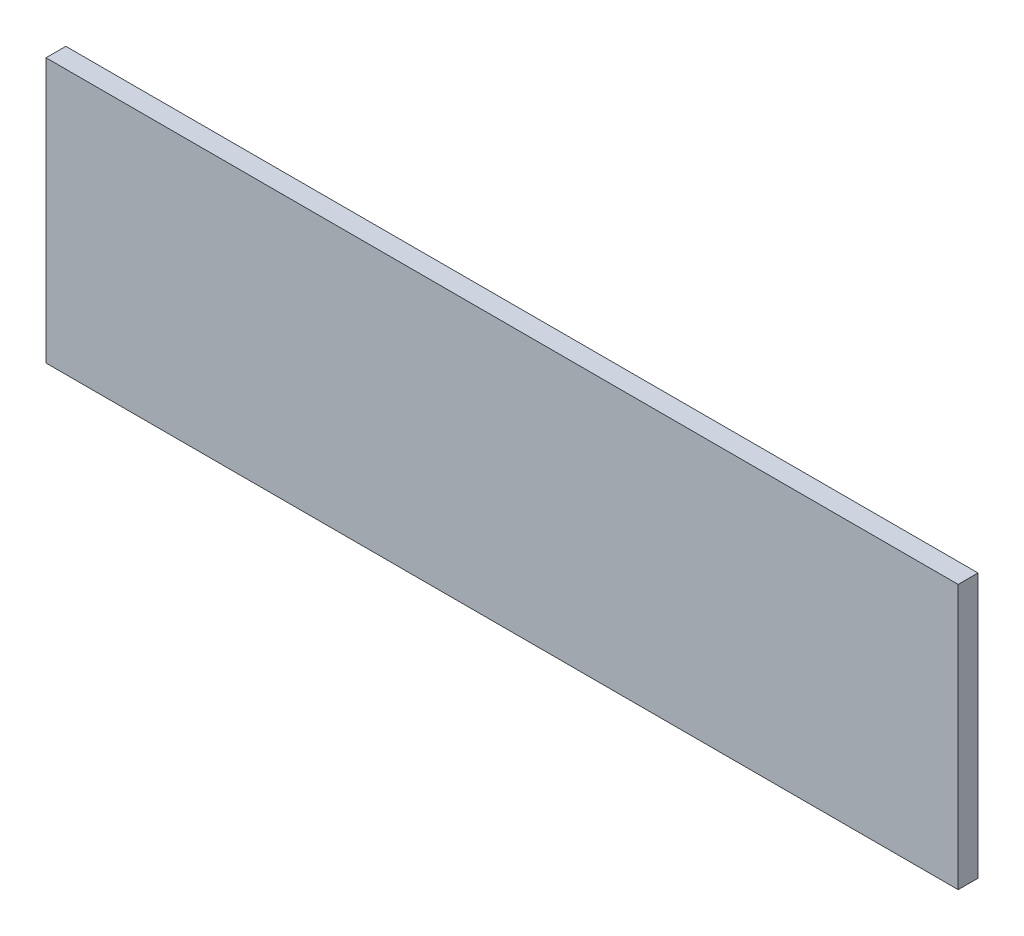
from build123d import *

# Parameters (mm, degrees)
CROQUIS1_W              = 690
CROQUIS1_H              = 200
SALIENTE_EXTRUIR1_DEPTH = 15


with BuildPart() as part:
    # Croquis1 → Saliente-Extruir1 (new body)
    with BuildSketch(Plane.XY):
        Rectangle(CROQUIS1_W, CROQUIS1_H)
    extrude(amount=SALIENTE_EXTRUIR1_DEPTH)


solid = part.part
